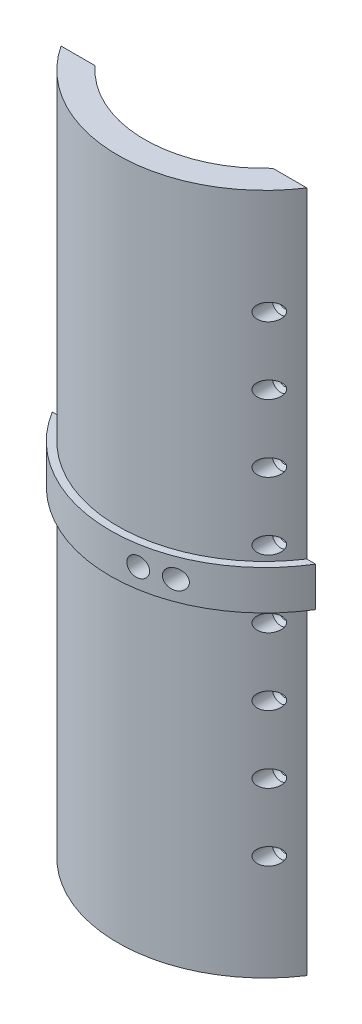
from build123d import *

# Parameters (mm, degrees)
BOSS_EXTRUDE1_DEPTH      = 233
LPATTERN1_COUNT          = 8
LPATTERN1_PITCH          = 23
BOSS_EXTRUDE2_DEPTH      = 6.731
BOSS_EXTRUDE2_DEPTH_BACK = 6.731
SKETCH9_R                = 3.334469726
CUT_EXTRUDE1_DEPTH       = 34


with BuildPart() as part:
    # Sketch1 → Boss-Extrude1 (new body)
    with BuildSketch(Plane(origin=(60.535204745, 0, -85.948449604), x_dir=(1, 0, 0), z_dir=(0, 1, 0))):
        with BuildLine():
            ThreePointArc((-30.186446753, -113.644462538), (-60.535204745, -127.035141416), (-90.883962736, -113.644462538))
            Line((-90.883962736, -113.644462538), (-102.513962844, -113.644462538))
            ThreePointArc((-102.513962844, -113.644462538), (-60.535204745, -136.240449604), (-18.556446645, -113.644462538))
            Line((-18.556446645, -113.644462538), (-30.186446753, -113.644462538))
        make_face()
    extrude(amount=BOSS_EXTRUDE1_DEPTH)

    # Sketch6 → Cut-Revolve4 (revolve, cut)
    with BuildSketch(Plane(origin=(36.163758045, 36, 27.696012934), x_dir=(-1, 0, 0), z_dir=(0, -1, 0))):
        Polygon((0, 1.685394277), (0, -4.78184701), (0, -15.185924704), (-2.9, -15.185924704), (-2.9, -3.079025683), (-1.65, -1.881964943), (-1.65, 1.685394277), align=None)
    cut_revolve4 = revolve(axis=Axis((36.163758045, 36, 26.010618657), (0, 0, 1)), mode=Mode.SUBTRACT)

    # LPattern1: Cut-Revolve4 ×8
    with Locations(*[(0, i * LPATTERN1_PITCH, 0) for i in range(1, LPATTERN1_COUNT)]):
        add(cut_revolve4, mode=Mode.SUBTRACT)

    # Mirror1: Cut-Revolve4 across plane
    add(cut_revolve4.mirror(Plane(origin=(0, 0, 0), x_dir=(0, 0, 1), z_dir=(1, 0, 0))), mode=Mode.SUBTRACT)

    # Mirror1 copy 1 sketch → Mirror1 copy 1 (revolve, cut)
    with BuildSketch(Plane(origin=(-36.163758045, 59, 27.696012934), x_dir=(1, 0, 0), z_dir=(0, -1, 0))):
        Polygon((0, -1.685394277), (0, 4.78184701), (0, 15.185924704), (-2.9, 15.185924704), (-2.9, 3.079025683), (-1.65, 1.881964943), (-1.65, -1.685394277), align=None)
    revolve(axis=Axis((-36.163758045, 59, 26.010618657), (0, 0, -1)), mode=Mode.SUBTRACT)

    # Mirror1 copy 2 sketch → Mirror1 copy 2 (revolve, cut)
    with BuildSketch(Plane(origin=(-36.163758045, 82, 27.696012934), x_dir=(1, 0, 0), z_dir=(0, -1, 0))):
        Polygon((0, -1.685394277), (0, 4.78184701), (0, 15.185924704), (-2.9, 15.185924704), (-2.9, 3.079025683), (-1.65, 1.881964943), (-1.65, -1.685394277), align=None)
    revolve(axis=Axis((-36.163758045, 82, 26.010618657), (0, 0, -1)), mode=Mode.SUBTRACT)

    # Mirror1 copy 3 sketch → Mirror1 copy 3 (revolve, cut)
    with BuildSketch(Plane(origin=(-36.163758045, 105, 27.696012934), x_dir=(1, 0, 0), z_dir=(0, -1, 0))):
        Polygon((0, -1.685394277), (0, 4.78184701), (0, 15.185924704), (-2.9, 15.185924704), (-2.9, 3.079025683), (-1.65, 1.881964943), (-1.65, -1.685394277), align=None)
    revolve(axis=Axis((-36.163758045, 105, 26.010618657), (0, 0, -1)), mode=Mode.SUBTRACT)

    # Mirror1 copy 4 sketch → Mirror1 copy 4 (revolve, cut)
    with BuildSketch(Plane(origin=(-36.163758045, 128, 27.696012934), x_dir=(1, 0, 0), z_dir=(0, -1, 0))):
        Polygon((0, -1.685394277), (0, 4.78184701), (0, 15.185924704), (-2.9, 15.185924704), (-2.9, 3.079025683), (-1.65, 1.881964943), (-1.65, -1.685394277), align=None)
    revolve(axis=Axis((-36.163758045, 128, 26.010618657), (0, 0, -1)), mode=Mode.SUBTRACT)

    # Mirror1 copy 5 sketch → Mirror1 copy 5 (revolve, cut)
    with BuildSketch(Plane(origin=(-36.163758045, 151, 27.696012934), x_dir=(1, 0, 0), z_dir=(0, -1, 0))):
        Polygon((0, -1.685394277), (0, 4.78184701), (0, 15.185924704), (-2.9, 15.185924704), (-2.9, 3.079025683), (-1.65, 1.881964943), (-1.65, -1.685394277), align=None)
    revolve(axis=Axis((-36.163758045, 151, 26.010618657), (0, 0, -1)), mode=Mode.SUBTRACT)

    # Mirror1 copy 6 sketch → Mirror1 copy 6 (revolve, cut)
    with BuildSketch(Plane(origin=(-36.163758045, 174, 27.696012934), x_dir=(1, 0, 0), z_dir=(0, -1, 0))):
        Polygon((0, -1.685394277), (0, 4.78184701), (0, 15.185924704), (-2.9, 15.185924704), (-2.9, 3.079025683), (-1.65, 1.881964943), (-1.65, -1.685394277), align=None)
    revolve(axis=Axis((-36.163758045, 174, 26.010618657), (0, 0, -1)), mode=Mode.SUBTRACT)

    # Mirror1 copy 7 sketch → Mirror1 copy 7 (revolve, cut)
    with BuildSketch(Plane(origin=(-36.163758045, 197, 27.696012934), x_dir=(1, 0, 0), z_dir=(0, -1, 0))):
        Polygon((0, -1.685394277), (0, 4.78184701), (0, 15.185924704), (-2.9, 15.185924704), (-2.9, 3.079025683), (-1.65, 1.881964943), (-1.65, -1.685394277), align=None)
    revolve(axis=Axis((-36.163758045, 197, 26.010618657), (0, 0, -1)), mode=Mode.SUBTRACT)

    # Sketch7 → Boss-Extrude2 (add, two sides: drawn at the far end of the back side and taken through both)
    with BuildSketch(Plane(origin=(0, 116.5, 0), x_dir=(-1, 0, 0), z_dir=(0, -1, 0)).offset(-BOSS_EXTRUDE2_DEPTH_BACK)):
        with BuildLine():
            Line((-44.990566695, -27.696012934), (-41.978758099, -27.696012934))
            ThreePointArc((-41.978758099, -27.696012934), (0, -50.292), (41.978758099, -27.696012934))
            Line((41.978758099, -27.696012934), (44.990566695, -27.696012934))
            ThreePointArc((44.990566695, -27.696012934), (0, -52.832), (-44.990566695, -27.696012934))
        make_face()
    extrude(amount=BOSS_EXTRUDE2_DEPTH + BOSS_EXTRUDE2_DEPTH_BACK)

    # Sketch9 → Cut-Extrude1 (cut)
    with BuildSketch(Plane(origin=(0, 0, 27.696012934), x_dir=(-1, 0, 0), z_dir=(0, 0, -1))):
        with Locations((-18.801989508, 116.5)):
            Circle(SKETCH9_R)
        with Locations((-8.69556827, 116.5)):
            Circle(SKETCH9_R)
    extrude(amount=-CUT_EXTRUDE1_DEPTH, mode=Mode.SUBTRACT)


solid = part.part
